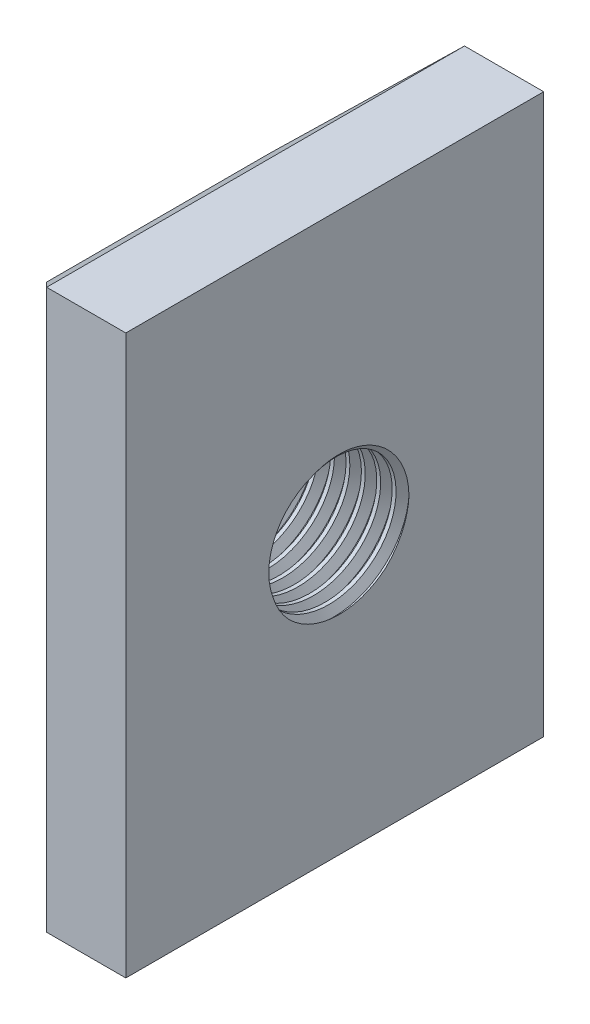
from build123d import *

# Parameters (mm, degrees)
BOSS_EXTRUDE1_DEPTH = 4.75
CHAMFER1_SIZE       = 2.2
CHAMFER2_SIZE       = 2.2
SKETCH2_R           = 1.5
CUT_EXTRUDE1_DEPTH  = 9.884941505
THREAD1_PITCH       = 0.35


with BuildPart() as part:
    # Sketch1 → Boss-Extrude1 (new, symmetric)
    with BuildSketch(Plane.XY):
        Polygon((0, -6.35), (0, 6.35), (-1.8, 6.35), (-4.007141817, 4.245), (-4.007141817, -4.245), (-1.8, -6.35), align=None)
    extrude(amount=BOSS_EXTRUDE1_DEPTH, both=True)

    # Chamfer1
    chamfer1_edges = [part.edges().sort_by_distance(p)[0] for p in [
        (-4.007141817, 0, 4.75),
    ]]
    chamfer(chamfer1_edges, length=CHAMFER1_SIZE)

    # Chamfer2
    chamfer2_edges = [part.edges().sort_by_distance(p)[0] for p in [
        (-4.007141817, 0, -4.75),
    ]]
    chamfer(chamfer2_edges, length=CHAMFER2_SIZE)

    # Sketch2 → Cut-Extrude1 (cut, through all)
    with BuildSketch(Plane(origin=(0, 0, 0), x_dir=(0, 0, -1), z_dir=(1, 0, 0))):
        Circle(SKETCH2_R)
    extrude(amount=-CUT_EXTRUDE1_DEPTH, mode=Mode.SUBTRACT)

    # Thread1: the profile of Thread Profile1 profile screwed along a right-hand helix of 28.571429 turns, 6 arcs to a turn; built about Z, then put on its axis
    thread1_z = Axis((0, 0, 0), (0, 0, 1))
    thread1_corners = [(1.4997, 0, -0.000173205), (1.689443056, 0, 0.109375), (1.689443056, 0, 0.153125), (1.4997, 0, 0.262673204)]
    with BuildLine(mode=Mode.PRIVATE) as thread1_profile:
        Line(thread1_corners[0], thread1_corners[1])
        Line(thread1_corners[1], thread1_corners[2])
        Line(thread1_corners[2], thread1_corners[3])
        Line(thread1_corners[3], thread1_corners[0])
    thread1_cap = Face(thread1_profile.wire())
    thread1_turn_angles = [0, 30, 60, 90, 120, 150, 180, 210, 240, 270, 300, 330, 360]
    thread1_turn_weights = [1, 0.8660254037844387, 1, 0.8660254037844387, 1, 0.8660254037844387, 1, 0.8660254037844387, 1, 0.8660254037844387, 1, 0.8660254037844387, 1]
    thread1_turn_rails = [Edge.make_bspline([Vector(p[0], p[1], 0).rotate(thread1_z, thread1_turn_angles[k]) / thread1_turn_weights[k] + Vector(0, 0, p[2] + THREAD1_PITCH * thread1_turn_angles[k] / 360) for k in range(13)], [0, 0, 0, 1, 1, 2, 2, 3, 3, 4, 4, 5, 5, 6, 6, 6], 2, thread1_turn_weights) for p in thread1_corners]
    thread1_turn_sides = [Face.make_surface_from_curves(thread1_turn_rails[p[0]], thread1_turn_rails[p[1]]) for p in [(0, 1), (1, 2), (2, 3), (3, 0)]]
    thread1_last_angles = [10080, 10110, 10140, 10170, 10200, 10230, 10260, 10272.857142857, 10285.714285714]
    thread1_last_weights = [1, 0.8660254037844387, 1, 0.8660254037844387, 1, 0.8660254037844387, 1, 0.9749279121818226, 1]
    thread1_last_rails = [Edge.make_bspline([Vector(p[0], p[1], 0).rotate(thread1_z, thread1_last_angles[k]) / thread1_last_weights[k] + Vector(0, 0, p[2] + THREAD1_PITCH * thread1_last_angles[k] / 360) for k in range(9)], [0, 0, 0, 1, 1, 2, 2, 3, 3, 4, 4, 4], 2, thread1_last_weights) for p in thread1_corners]
    thread1_last_sides = [Face.make_surface_from_curves(thread1_last_rails[p[0]], thread1_last_rails[p[1]]) for p in [(0, 1), (1, 2), (2, 3), (3, 0)]]
    thread1 = Plane(origin=(-5.007141817, 0, 0), x_dir=(0, 0, -1), z_dir=(1, 0, 0)) * Solid(Shell([*[p.moved(Location((0, 0, THREAD1_PITCH * i))) for i in range(28) for p in thread1_turn_sides], *thread1_last_sides, thread1_cap, thread1_cap.rotate(thread1_z, 10285.714285714).moved(Location((0, 0, THREAD1_PITCH * 10285.714285714 / 360)))]))
    add(thread1, mode=Mode.SUBTRACT)


solid = part.part
